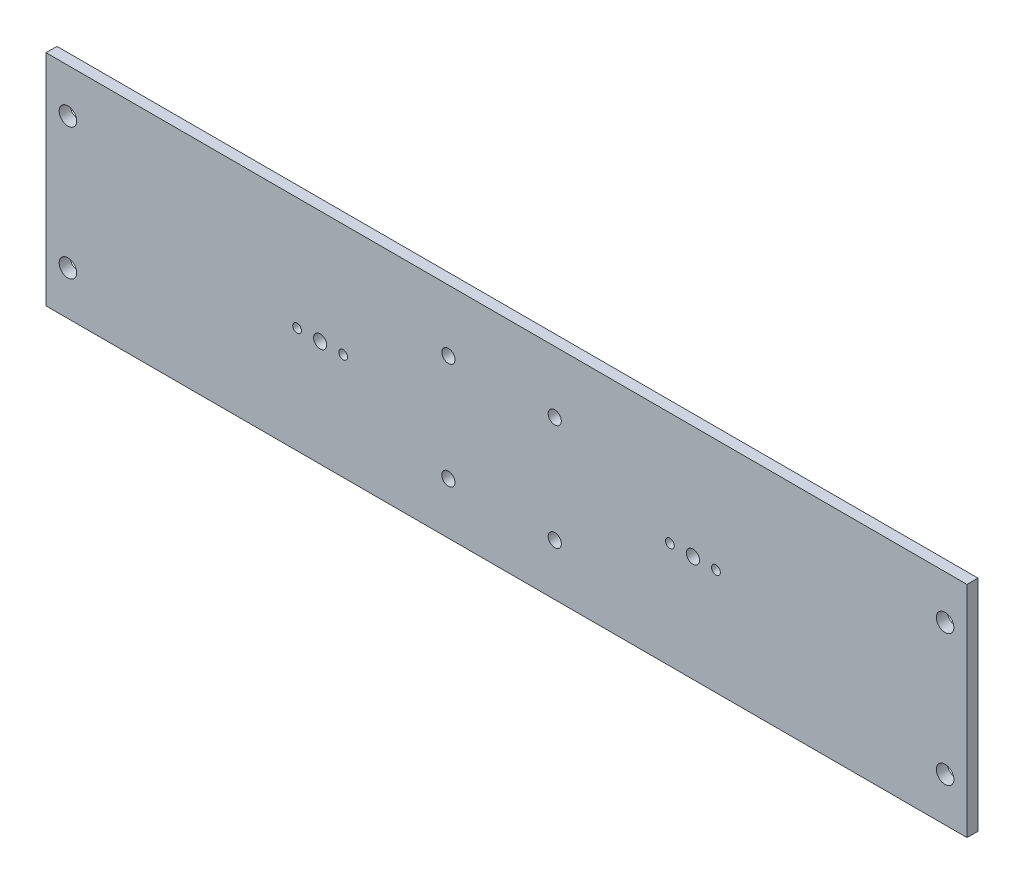
from build123d import *

# Parameters (mm, degrees)
SKETCH2_W           = 420
SKETCH2_H           = 100
BOSS_EXTRUDE1_DEPTH = 5
SKETCH8_R           = 3
CUT_EXTRUDE2_DEPTH  = 432.769614494
SKETCH9_R           = 3
SKETCH9_R_2         = 2
CUT_EXTRUDE3_DEPTH  = 432.769614494
SKETCH11_R          = 4
CUT_EXTRUDE4_DEPTH  = 432.769614494


with BuildPart() as part:
    # Sketch2 → Boss-Extrude1 (new body)
    with BuildSketch(Plane.XY):
        with Locations((210, 50)):
            Rectangle(SKETCH2_W, SKETCH2_H)
    extrude(amount=BOSS_EXTRUDE1_DEPTH)

    # Sketch8 → Cut-Extrude2 (cut, through all)
    with BuildSketch(Plane.XY.offset(5)):
        with Locations((183.5, 23.5)):
            Circle(SKETCH8_R)
        with Locations((183.5, 72)):
            Circle(SKETCH8_R)
        with Locations((232, 72)):
            Circle(SKETCH8_R)
        with Locations((232, 23.5)):
            Circle(SKETCH8_R)
    extrude(amount=-CUT_EXTRUDE2_DEPTH, mode=Mode.SUBTRACT)

    # Sketch9 → Cut-Extrude3 (cut, through all)
    with BuildSketch(Plane.XY.offset(5)):
        with Locations((125, 48.5)):
            Circle(SKETCH9_R)
        with Locations((135.5, 48.5)):
            Circle(SKETCH9_R_2)
        with Locations((114.5, 48.5)):
            Circle(SKETCH9_R_2)
        with Locations((295, 48.5)):
            Circle(SKETCH9_R)
        with Locations((305.5, 48.5)):
            Circle(SKETCH9_R_2)
        with Locations((284.5, 48.5)):
            Circle(SKETCH9_R_2)
    extrude(amount=-CUT_EXTRUDE3_DEPTH, mode=Mode.SUBTRACT)

    # Sketch11 → Cut-Extrude4 (cut, through all)
    with BuildSketch(Plane.XY.offset(5)):
        with Locations((10, 80)):
            Circle(SKETCH11_R)
        with Locations((10, 20)):
            Circle(SKETCH11_R)
        with Locations((410, 20)):
            Circle(SKETCH11_R)
        with Locations((410, 80)):
            Circle(SKETCH11_R)
    extrude(amount=-CUT_EXTRUDE4_DEPTH, mode=Mode.SUBTRACT)


solid = part.part
